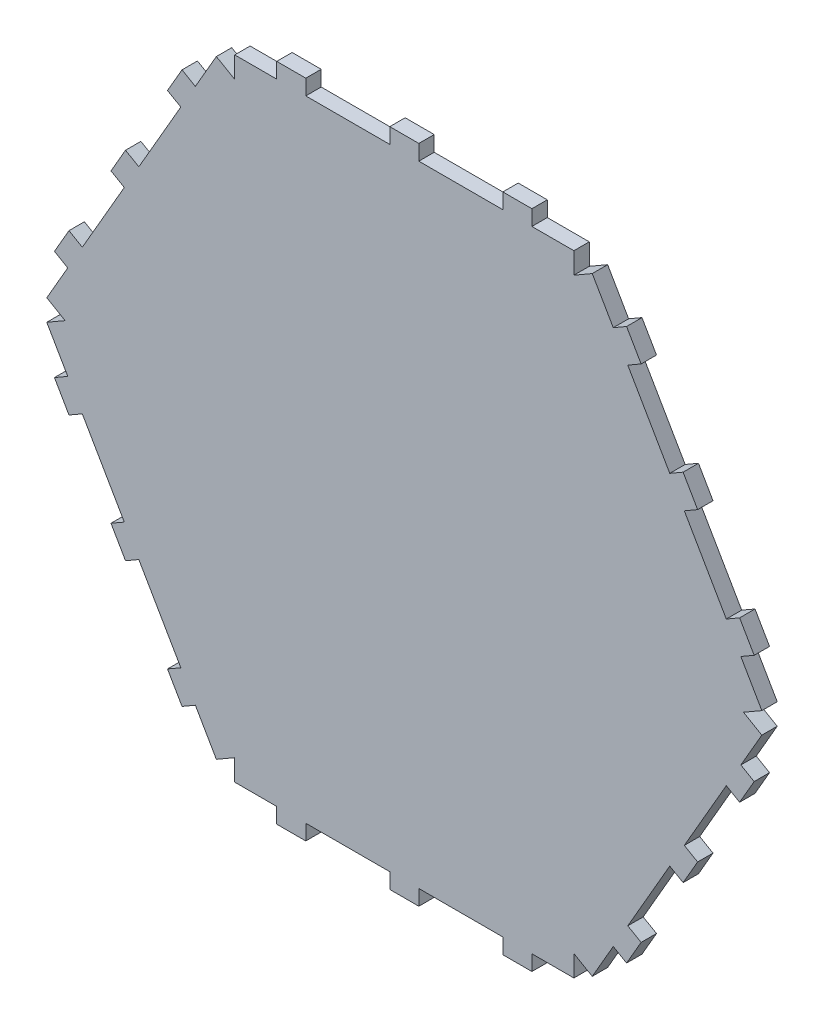
from build123d import *

# Parameters (mm, degrees)
BOSS_EXTRUDE1_DEPTH = 1.5875


with BuildPart() as part:
    # Sketch2 → Boss-Extrude1 (new, symmetric)
    with BuildSketch(Plane.XY):
        Polygon((-26.333333333, 65), (-35, 65), (-35, 60.621778265), (-38.791651246, 62.810889132), (-43.124984579, 55.305335633), (-45.874615236, 56.892835633), (-48.874615236, 51.69668321), (-46.124984579, 50.10918321), (-54.791651246, 35.098076211), (-57.541281903, 36.685576211), (-60.541281903, 31.489423789), (-57.791651246, 29.901923789), (-66.458317913, 14.89081679), (-69.20794857, 16.47831679), (-72.20794857, 11.282164367), (-69.458317913, 9.694664367), (-73.791651246, 2.189110868), (-70, 0), (-73.791651246, -2.189110868), (-69.458317913, -9.694664367), (-72.20794857, -11.282164367), (-69.20794857, -16.47831679), (-66.458317913, -14.89081679), (-57.791651246, -29.901923789), (-60.541281903, -31.489423789), (-57.541281903, -36.685576211), (-54.791651246, -35.098076211), (-46.124984579, -50.10918321), (-48.874615236, -51.69668321), (-45.874615236, -56.892835633), (-43.124984579, -55.305335633), (-38.791651246, -62.810889132), (-35, -60.621778265), (-35, -65), (-26.333333333, -65), (-26.333333333, -68.175), (-20.333333333, -68.175), (-20.333333333, -65), (-3, -65), (-3, -68.175), (3, -68.175), (3, -65), (20.333333333, -65), (20.333333333, -68.175), (26.333333333, -68.175), (26.333333333, -65), (35, -65), (35, -60.621778265), (38.791651246, -62.810889132), (43.124984579, -55.305335633), (45.874615236, -56.892835633), (48.874615236, -51.69668321), (46.124984579, -50.10918321), (54.791651246, -35.098076211), (57.541281903, -36.685576211), (60.541281903, -31.489423789), (57.791651246, -29.901923789), (66.458317913, -14.89081679), (69.20794857, -16.47831679), (72.20794857, -11.282164367), (69.458317913, -9.694664367), (73.791651246, -2.189110868), (70, 0), (73.791651246, 2.189110868), (69.458317913, 9.694664367), (72.20794857, 11.282164367), (69.20794857, 16.47831679), (66.458317913, 14.89081679), (57.791651246, 29.901923789), (60.541281903, 31.489423789), (57.541281903, 36.685576211), (54.791651246, 35.098076211), (46.124984579, 50.10918321), (48.874615236, 51.69668321), (45.874615236, 56.892835633), (43.124984579, 55.305335633), (38.791651246, 62.810889132), (35, 60.621778265), (35, 65), (26.333333333, 65), (26.333333333, 68.175), (20.333333333, 68.175), (20.333333333, 65), (3, 65), (3, 68.175), (-3, 68.175), (-3, 65), (-20.333333333, 65), (-20.333333333, 68.175), (-26.333333333, 68.175), align=None)
    extrude(amount=BOSS_EXTRUDE1_DEPTH, both=True)


solid = part.part
